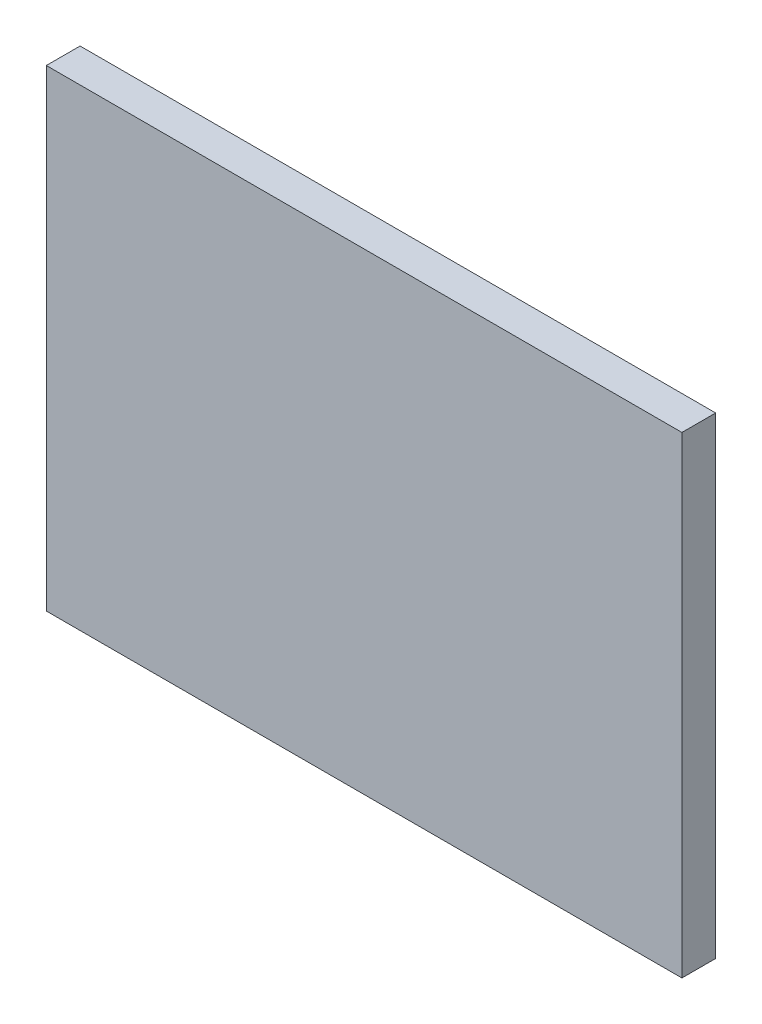
from build123d import *

# Parameters (mm, degrees)
SIDEOUTLINE_W               = 215.265
SIDEOUTLINE_H               = 160.02
SIDEOUTLINE_THICKNESS_DEPTH = 11.43


with BuildPart() as part:
    # SideOutline → SideOutline_Thickness (new body)
    with BuildSketch(Plane.XY):
        with Locations((-4873.3075, 1299.21)):
            Rectangle(SIDEOUTLINE_W, SIDEOUTLINE_H)
    extrude(amount=-SIDEOUTLINE_THICKNESS_DEPTH)


solid = part.part
